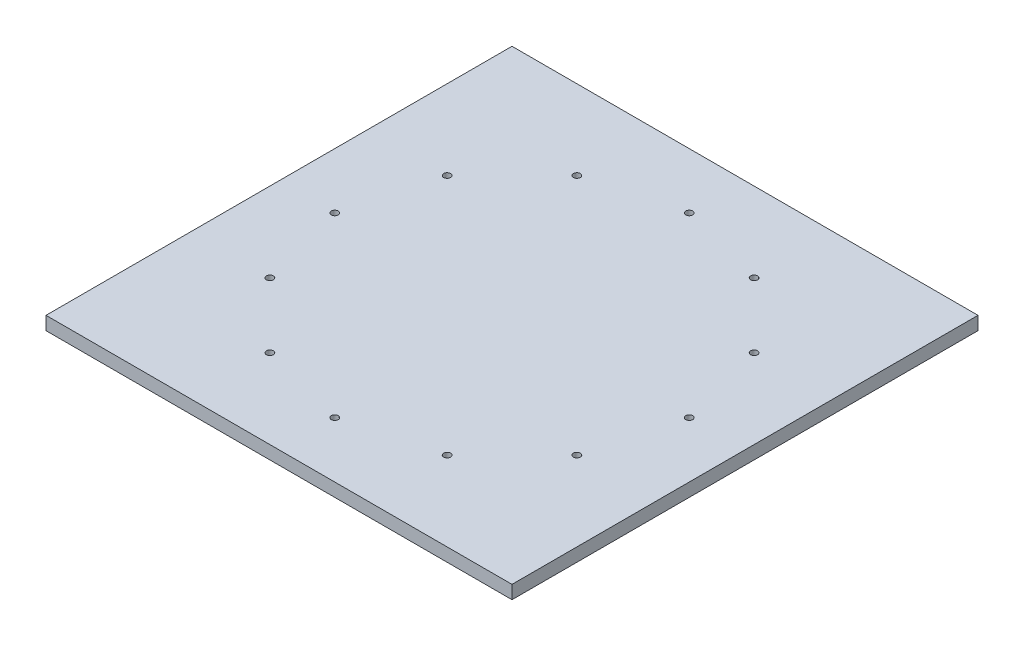
from build123d import *

# Parameters (mm, degrees)
SKETCH1_W             = 177.8
SKETCH1_H             = 177.8
SKETCH1_R             = 1.3208
BOSS_EXTRUDE1_DEPTH   = 5.08
CIRPATTERN1_OUTLINE_R = 1.3208
CIRPATTERN1_DEPTH     = 5.08


# Read off the part's stored shape, not the designer's step: CirPattern1
with BuildPart() as part:
    # Sketch1 → Boss-Extrude1 (new body)
    with BuildSketch(Plane(origin=(0, 0, 0), x_dir=(1, 0, 0), z_dir=(0, 1, 0))):
        Rectangle(SKETCH1_W, SKETCH1_H)
        with Locations(Location((0, -67.6275, 0), (0, 0, 270))):
            Circle(SKETCH1_R, mode=Mode.SUBTRACT)
    extrude(amount=BOSS_EXTRUDE1_DEPTH)

    # CirPattern1 outline → CirPattern1 (cut)
    with BuildSketch(Plane(origin=(0, 0, 0), x_dir=(1, 0, 0), z_dir=(0, 1, 0))):
        with Locations((33.81375, -58.567132994)):
            Circle(CIRPATTERN1_OUTLINE_R)
        with Locations((58.567132994, -33.81375)):
            Circle(CIRPATTERN1_OUTLINE_R)
        with Locations((67.6275, 0)):
            Circle(CIRPATTERN1_OUTLINE_R)
        with Locations((58.567132994, 33.81375)):
            Circle(CIRPATTERN1_OUTLINE_R)
        with Locations((33.81375, 58.567132994)):
            Circle(CIRPATTERN1_OUTLINE_R)
        with Locations((0, 67.6275)):
            Circle(CIRPATTERN1_OUTLINE_R)
        with Locations((-33.81375, 58.567132994)):
            Circle(CIRPATTERN1_OUTLINE_R)
        with Locations((-58.567132994, 33.81375)):
            Circle(CIRPATTERN1_OUTLINE_R)
        with Locations((-67.6275, 0)):
            Circle(CIRPATTERN1_OUTLINE_R)
        with Locations((-58.567132994, -33.81375)):
            Circle(CIRPATTERN1_OUTLINE_R)
        with Locations((-33.81375, -58.567132994)):
            Circle(CIRPATTERN1_OUTLINE_R)
    extrude(amount=CIRPATTERN1_DEPTH, mode=Mode.SUBTRACT)


solid = part.part
